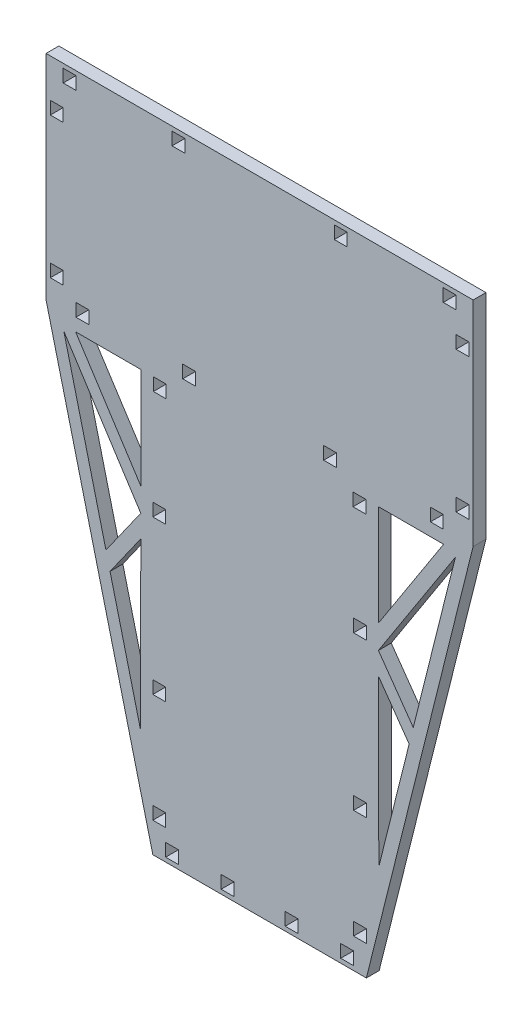
from build123d import *

# Parameters (mm, degrees)
BOSS_EXTRUDE1_DEPTH = 6
SKETCH4_W           = 6
SKETCH4_H           = 6
CUT_EXTRUDE2_DEPTH  = 6


with BuildPart() as part:
    # Sketch1 → Boss-Extrude1 (new body)
    with BuildSketch(Plane.XY):
        Polygon((100, 300), (100, 200), (50, 0), (-50, 0), (-100, 200), (-100, 300), align=None)
    extrude(amount=BOSS_EXTRUDE1_DEPTH)

    # Sketch4 → Cut-Extrude2 (cut)
    with BuildSketch(Plane(origin=(0, 0, 0), x_dir=(-1, 0, 0), z_dir=(0, 0, -1))):
        with Locations((-249.21822542, 247.31110849)):
            Rectangle(SKETCH4_W, SKETCH4_H)
        with Locations((-95, 279)):
            Rectangle(SKETCH4_W, SKETCH4_H)
        with Locations((-95, 213)):
            Rectangle(SKETCH4_W, SKETCH4_H)
        with Locations((-89, 295)):
            Rectangle(SKETCH4_W, SKETCH4_H)
        with Locations((-41, 5)):
            Rectangle(SKETCH4_W, SKETCH4_H)
        with Locations((-38, 295)):
            Rectangle(SKETCH4_W, SKETCH4_H)
        with Locations((-83, 203)):
            Rectangle(SKETCH4_W, SKETCH4_H)
        with Locations((-33, 203)):
            Rectangle(SKETCH4_W, SKETCH4_H)
        with Locations((-15, 5)):
            Rectangle(SKETCH4_W, SKETCH4_H)
        with Locations((-47, 17)):
            Rectangle(SKETCH4_W, SKETCH4_H)
        with Locations((-47, 68)):
            Rectangle(SKETCH4_W, SKETCH4_H)
        with Locations((-46.748754565, 191)):
            Rectangle(SKETCH4_W, SKETCH4_H)
        with Locations((-47, 140)):
            Rectangle(SKETCH4_W, SKETCH4_H)
        with Locations((38, 295)):
            Rectangle(SKETCH4_W, SKETCH4_H)
        with Locations((89, 295)):
            Rectangle(SKETCH4_W, SKETCH4_H)
        with Locations((95, 279)):
            Rectangle(SKETCH4_W, SKETCH4_H)
        with Locations((83, 203)):
            Rectangle(SKETCH4_W, SKETCH4_H)
        with Locations((95, 213)):
            Rectangle(SKETCH4_W, SKETCH4_H)
        with Locations((46.748754565, 191)):
            Rectangle(SKETCH4_W, SKETCH4_H)
        with Locations((47, 140)):
            Rectangle(SKETCH4_W, SKETCH4_H)
        with Locations((47, 68)):
            Rectangle(SKETCH4_W, SKETCH4_H)
        with Locations((47, 17)):
            Rectangle(SKETCH4_W, SKETCH4_H)
        with Locations((41, 5)):
            Rectangle(SKETCH4_W, SKETCH4_H)
        with Locations((15, 5)):
            Rectangle(SKETCH4_W, SKETCH4_H)
        with Locations((33, 203)):
            Rectangle(SKETCH4_W, SKETCH4_H)
        Polygon((55.622098795, 194), (86.171284614, 194), (55.622098795, 146.710661579), align=None)
        Polygon((55.640072778, 135.681178614), (91.684652057, 191.47724198), (71.962334114, 112.587970208), align=None)
        Polygon((70.042546798, 104.908820946), (55.622098795, 125.311288729), (55.832173802, 48.067328963), align=None)
        Polygon((-55.832173802, 48.067328963), (-70.042546798, 104.908820946), (-55.622098795, 125.311288729), align=None)
        Polygon((-71.962334114, 112.587970208), (-55.640072778, 135.681178614), (-91.684652057, 191.47724198), align=None)
        Polygon((-86.171284614, 194), (-55.622098795, 146.710661579), (-55.622098795, 194), align=None)
    extrude(amount=-CUT_EXTRUDE2_DEPTH, mode=Mode.SUBTRACT)


solid = part.part
